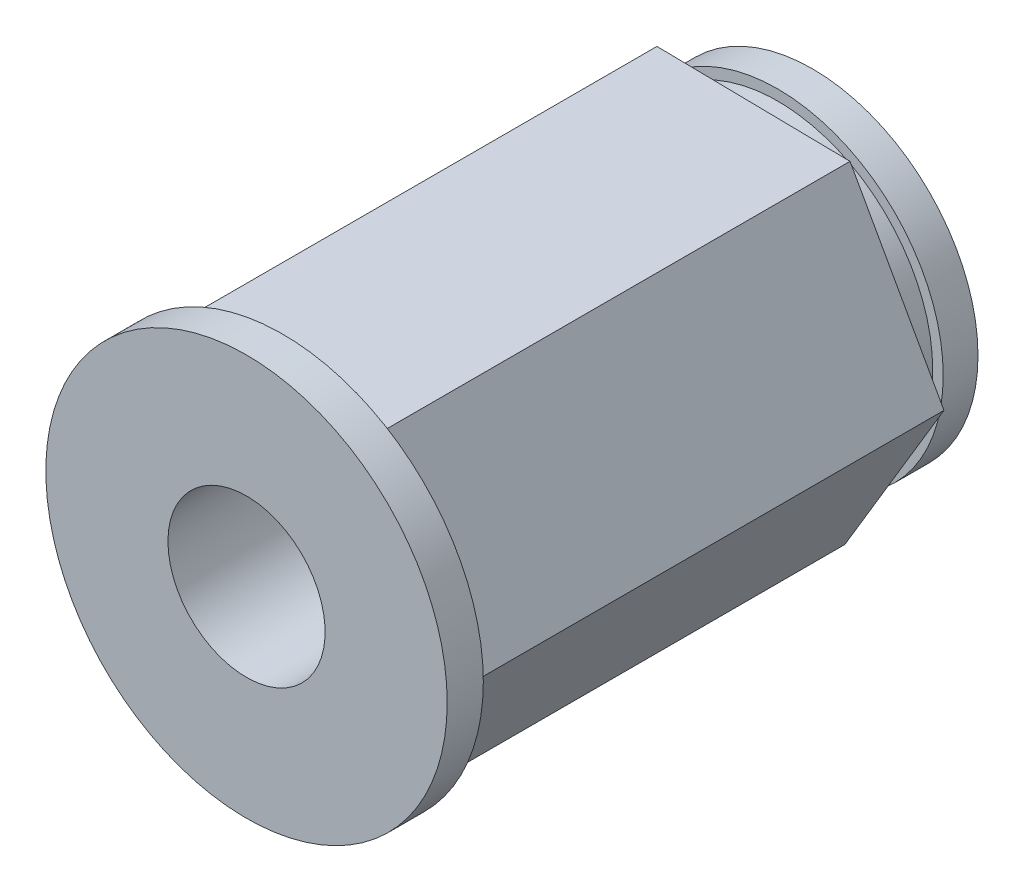
from build123d import *

# Parameters (mm, degrees)
BOSS_EXTRUDE1_DEPTH      = 8.89
BOSS_EXTRUDE1_DEPTH_BACK = 8.89
SKETCH2_R                = 7.62
BOSS_EXTRUDE3_DEPTH      = 1.3716
SKETCH4_R                = 5.88645
BOSS_EXTRUDE4_DEPTH      = 1.016
SKETCH5_R                = 6.2865
BOSS_EXTRUDE5_DEPTH      = 1.3208
SKETCH6_R                = 2.9845
CUT_EXTRUDE2_DEPTH       = 25.039137559


with BuildPart() as part:
    # Sketch1 → Boss-Extrude1 (new, two sides: drawn at the far end of the back side and taken through both)
    with BuildSketch(Plane.XY.offset(-BOSS_EXTRUDE1_DEPTH_BACK)):
        Polygon((3.763810109, 6.292620026), (-3.567663745, 6.405865183), (-7.331473854, 0.113245156), (-3.763810109, -6.292620026), (3.567663745, -6.405865183), (7.331473854, -0.113245156), align=None)
    extrude(amount=BOSS_EXTRUDE1_DEPTH + BOSS_EXTRUDE1_DEPTH_BACK)

    # Sketch2 → Boss-Extrude3 (add)
    with BuildSketch(Plane.XY.offset(8.89)):
        Circle(SKETCH2_R)
    extrude(amount=BOSS_EXTRUDE3_DEPTH)

    # Sketch4 → Boss-Extrude4 (add)
    with BuildSketch(Plane(origin=(0, 0, -8.89), x_dir=(-1, 0, 0), z_dir=(0, 0, -1))):
        Circle(SKETCH4_R)
    extrude(amount=BOSS_EXTRUDE4_DEPTH)

    # Sketch5 → Boss-Extrude5 (add)
    with BuildSketch(Plane(origin=(0, 0, -9.906), x_dir=(-1, 0, 0), z_dir=(0, 0, -1))):
        Circle(SKETCH5_R)
    extrude(amount=BOSS_EXTRUDE5_DEPTH)

    # Sketch6 → Cut-Extrude2 (cut, through all)
    with BuildSketch(Plane(origin=(0, 0, -11.2268), x_dir=(-1, 0, 0), z_dir=(0, 0, -1))):
        Circle(SKETCH6_R)
    extrude(amount=-CUT_EXTRUDE2_DEPTH, mode=Mode.SUBTRACT)


solid = part.part
